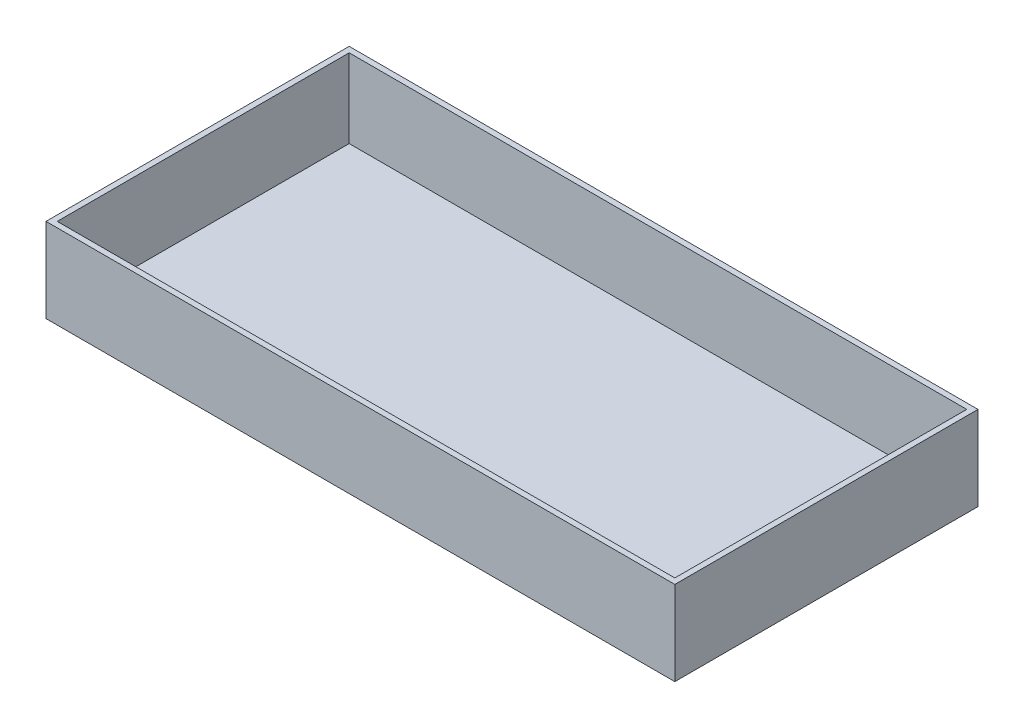
from build123d import *

# Parameters (mm, degrees)
SKETCH_1_W      = 560
SKETCH_1_H      = 270
EXTRUDE_1_DEPTH = 75
SHELL_1_T       = -5


with BuildPart() as part:
    # ｽｹｯﾁ1 → ﾎﾞｽ - 押し出し1 (new body)
    with BuildSketch(Plane(origin=(0, 0, 0), x_dir=(1, 0, 0), z_dir=(0, 1, 0))):
        Rectangle(SKETCH_1_W, SKETCH_1_H)
    extrude(amount=EXTRUDE_1_DEPTH)

    # ｼｪﾙ1
    shell_1_openings = [part.faces().sort_by_distance(p)[0] for p in [
        (0, 75, 0),
    ]]
    offset(amount=SHELL_1_T, openings=shell_1_openings, kind=Kind.INTERSECTION)


solid = part.part
